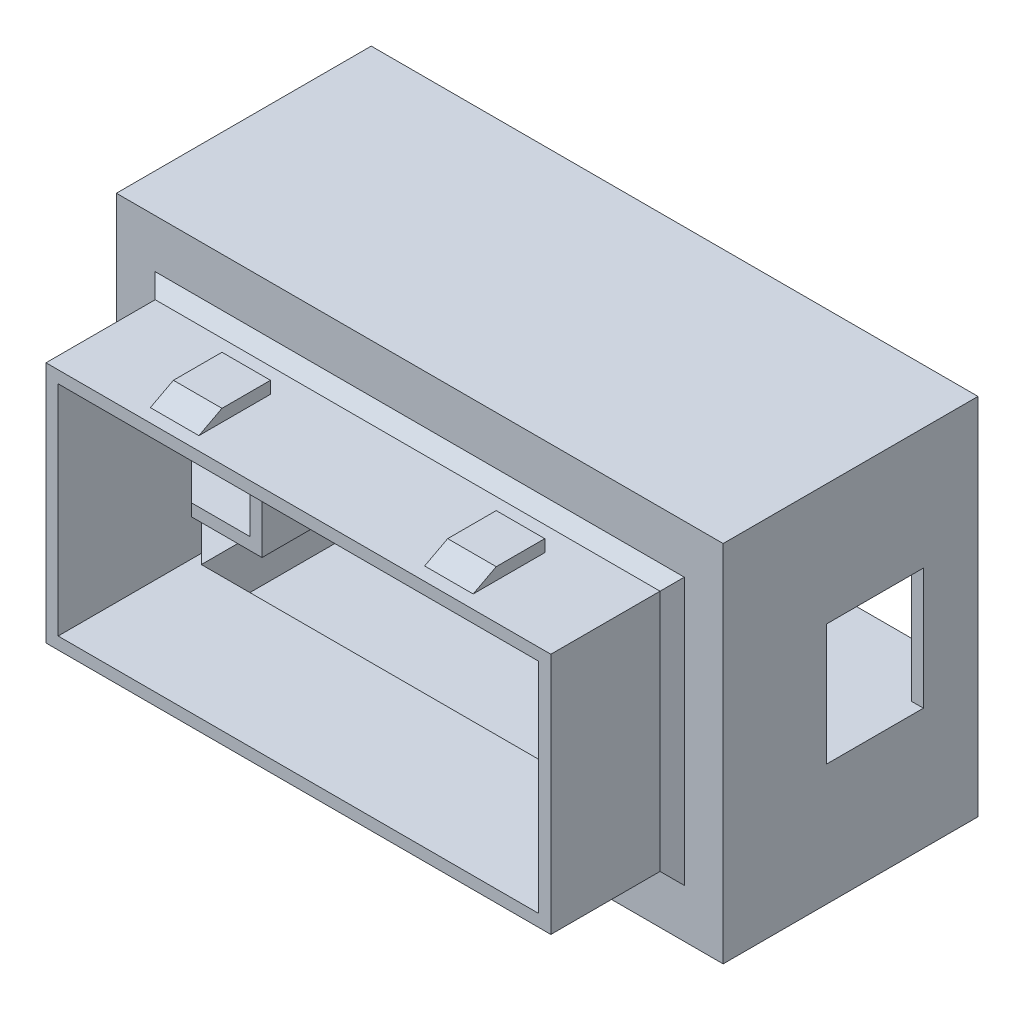
from build123d import *

# Parameters (mm, degrees)
SKETCH1_W            = 41.6
SKETCH1_H            = 20
SKETCH1_W_2          = 39.6
SKETCH1_H_2          = 18
BOSS_EXTRUDE2_DEPTH  = 10
SKETCH2_W            = 4
SKETCH2_H            = 10
BOSS_EXTRUDE3_DEPTH  = 1
SKETCH3_W            = 3
SKETCH3_H            = 1
CUT_EXTRUDE1_DEPTH   = 27
SKETCH4_W            = 4
SKETCH4_H            = 10
BOSS_EXTRUDE4_DEPTH  = 1
SKETCH5_W            = 3
SKETCH5_H            = 1
CUT_EXTRUDE2_DEPTH   = 27
SKETCH6_W            = 50
SKETCH6_H            = 30
SKETCH6_W_2          = 41.6
SKETCH6_H_2          = 20
SKETCH6_W_3          = 39.6
SKETCH6_H_3          = 18
BOSS_EXTRUDE6_DEPTH  = 1
CHAMFER1_SIZE        = 1
SKETCH7_W            = 50
SKETCH7_H            = 30
SKETCH7_W_2          = 48
SKETCH7_H_2          = 28
BOSS_EXTRUDE7_DEPTH  = 20
SKETCH8_W            = 4.2
SKETCH8_H            = 1
BOSS_EXTRUDE8_DEPTH  = 20
SKETCH9_W            = 4.2
SKETCH9_H            = 1
BOSS_EXTRUDE9_DEPTH  = 20
SKETCH10_W           = 4
SKETCH10_H           = 4
BOSS_EXTRUDE10_DEPTH = 20
SKETCH11_W           = 2
SKETCH11_H           = 10
CUT_EXTRUDE3_DEPTH   = 1
SKETCH12_W           = 2
SKETCH12_H           = 10
CUT_EXTRUDE4_DEPTH   = 1
SKETCH13_R           = 1.5
CUT_EXTRUDE5_DEPTH   = 10
CHAMFER2_SIZE        = 5
CHAMFER3_SIZE        = 5
CHAMFER4_SIZE        = 4


# Some blends are built 0.0001 mm under size
with BuildPart() as part:
    # Sketch1 → Boss-Extrude2 (new body)
    with BuildSketch(Plane.XY):
        Rectangle(SKETCH1_W, SKETCH1_H)
        Rectangle(SKETCH1_W_2, SKETCH1_H_2, mode=Mode.SUBTRACT)
    extrude(amount=BOSS_EXTRUDE2_DEPTH)

    # Sketch2 → Boss-Extrude3 (add)
    with BuildSketch(Plane.XZ.offset(10)):
        with Locations((-11.3, 5)):
            Rectangle(SKETCH2_W, SKETCH2_H)
        with Locations((11.3, 5)):
            Rectangle(SKETCH2_W, SKETCH2_H)
    extrude(amount=BOSS_EXTRUDE3_DEPTH)

    # Sketch3 → Cut-Extrude1 (cut)
    with BuildSketch(Plane.ZY.offset(13.3)):
        Polygon((8.900149248, -10), (7, -11), (10, -11), (10, -10), align=None)
        with Locations((1.5, -10.5)):
            Rectangle(SKETCH3_W, SKETCH3_H)
    extrude(amount=-CUT_EXTRUDE1_DEPTH, mode=Mode.SUBTRACT)

    # Sketch4 → Boss-Extrude4 (add)
    with BuildSketch(Plane(origin=(0, 10, 0), x_dir=(1, 0, 0), z_dir=(0, 1, 0))):
        with Locations((11.3, -5)):
            Rectangle(SKETCH4_W, SKETCH4_H)
        with Locations((-11.3, -5)):
            Rectangle(SKETCH4_W, SKETCH4_H)
    extrude(amount=BOSS_EXTRUDE4_DEPTH)

    # Sketch5 → Cut-Extrude2 (cut)
    with BuildSketch(Plane(origin=(13.3, 0, 0), x_dir=(0, 0, -1), z_dir=(1, 0, 0))):
        Polygon((-7, 11), (-10, 11), (-10, 10), (-8.900149248, 10), align=None)
        with Locations((-1.5, 10.5)):
            Rectangle(SKETCH5_W, SKETCH5_H)
    extrude(amount=-CUT_EXTRUDE2_DEPTH, mode=Mode.SUBTRACT)

    # Sketch6 → Boss-Extrude6 (add)
    # profile 1 of 2: a face of its own
    with BuildSketch(Plane(origin=(0, 0, 0), x_dir=(-1, 0, 0), z_dir=(0, 0, -1))):
        Rectangle(SKETCH6_W, SKETCH6_H)
        Rectangle(SKETCH6_W_2, SKETCH6_H_2, mode=Mode.SUBTRACT)
    # profile 2 of 2: a face of its own
    with BuildSketch(Plane(origin=(0, 0, 0), x_dir=(-1, 0, 0), z_dir=(0, 0, -1))):
        Rectangle(SKETCH6_W_2, SKETCH6_H_2)
        Rectangle(SKETCH6_W_3, SKETCH6_H_3, mode=Mode.SUBTRACT)
    extrude(amount=BOSS_EXTRUDE6_DEPTH)

    # Chamfer1
    chamfer1_edges = [part.edges().sort_by_distance(p)[0] for p in [
        (0, -10, 0),
        (-20.8, 0, 0),
        (0, 10, 0),
        (20.8, 0, 0),
    ]]
    chamfer(chamfer1_edges, length=CHAMFER1_SIZE)

    # Sketch7 → Boss-Extrude7 (add)
    with BuildSketch(Plane(origin=(0, 0, -1), x_dir=(-1, 0, 0), z_dir=(0, 0, -1))):
        Rectangle(SKETCH7_W, SKETCH7_H)
        Rectangle(SKETCH7_W_2, SKETCH7_H_2, mode=Mode.SUBTRACT)
    extrude(amount=BOSS_EXTRUDE7_DEPTH)

    # Sketch8 → Boss-Extrude8 (add)
    with BuildSketch(Plane(origin=(0, 0, -1), x_dir=(-1, 0, 0), z_dir=(0, 0, -1))):
        Polygon((-15, -5), (-19.8, -5), (-19.8, -6), (-14, -6), (-14, 6), (-19.8, 6), (-19.8, 5), (-15, 5), align=None)
        with Locations((-21.9, 5.5)):
            Rectangle(SKETCH8_W, SKETCH8_H)
        with Locations((-21.9, -5.5)):
            Rectangle(SKETCH8_W, SKETCH8_H)
    extrude(amount=BOSS_EXTRUDE8_DEPTH)

    # Sketch9 → Boss-Extrude9 (add)
    with BuildSketch(Plane(origin=(0, 0, -1), x_dir=(-1, 0, 0), z_dir=(0, 0, -1))):
        Polygon((15, 5), (19.8, 5), (19.8, 6), (14, 6), (14, -6), (19.8, -6), (19.8, -5), (15, -5), align=None)
        with Locations((21.9, 5.5)):
            Rectangle(SKETCH9_W, SKETCH9_H)
        with Locations((21.9, -5.5)):
            Rectangle(SKETCH9_W, SKETCH9_H)
    extrude(amount=BOSS_EXTRUDE9_DEPTH)

    # Sketch10 → Boss-Extrude10 (add)
    with BuildSketch(Plane(origin=(0, 0, -1), x_dir=(-1, 0, 0), z_dir=(0, 0, -1))):
        with Locations((-22, 12)):
            Rectangle(SKETCH10_W, SKETCH10_H)
        with Locations((22, 12)):
            Rectangle(SKETCH10_W, SKETCH10_H)
        with Locations((22, -12)):
            Rectangle(SKETCH10_W, SKETCH10_H)
        with Locations((-22, -12)):
            Rectangle(SKETCH10_W, SKETCH10_H)
    extrude(amount=BOSS_EXTRUDE10_DEPTH)

    # Sketch11 → Cut-Extrude3 (cut)
    with BuildSketch(Plane.ZY.offset(25)):
        Polygon((-10.5, -5), (-10.5, 5), (-16.5, 5), (-16.5, 0), (-16.5, -5), align=None)
        with Locations((-9.5, 0)):
            Rectangle(SKETCH11_W, SKETCH11_H)
    extrude(amount=-CUT_EXTRUDE3_DEPTH, mode=Mode.SUBTRACT)

    # Sketch12 → Cut-Extrude4 (cut)
    with BuildSketch(Plane(origin=(25, 0, 0), x_dir=(0, 0, -1), z_dir=(1, 0, 0))):
        with Locations((9.5, 0)):
            Rectangle(SKETCH12_W, SKETCH12_H)
        Polygon((16.5, 5), (10.5, 5), (10.5, -5), (16.5, -5), (16.5, 0), align=None)
    extrude(amount=-CUT_EXTRUDE4_DEPTH, mode=Mode.SUBTRACT)

    # Sketch13 → Cut-Extrude5 (cut)
    with BuildSketch(Plane(origin=(0, 0, -21), x_dir=(-1, 0, 0), z_dir=(0, 0, -1))):
        with Locations((-22.5, 12.5)):
            Circle(SKETCH13_R)
        with Locations((22.5, 12.5)):
            Circle(SKETCH13_R)
        with Locations((22.5, -12.5)):
            Circle(SKETCH13_R)
        with Locations((-22.5, -12.5)):
            Circle(SKETCH13_R)
    extrude(amount=-CUT_EXTRUDE5_DEPTH, mode=Mode.SUBTRACT)

    # Chamfer2
    chamfer2_edges = [part.edges().sort_by_distance(p)[0] for p in [
        (0, 14, -1),
        (0, -14, -1),
    ]]
    chamfer(chamfer2_edges, length=CHAMFER2_SIZE - 0.0001)  # a hair under: the kernel refuses the full size

    # Chamfer3
    # the kernel refuses this chamfer: 5 mm, written as the material it adds along each edge
    with BuildSketch(Plane(origin=(24, -21.85851494, -1), x_dir=(-0.9996219169112968, 0, 0.02749587661058636), z_dir=(0, 1, 0))) as chamfer3_piece_1_section:
        Polygon((CHAMFER3_SIZE * 0.999621916911, -CHAMFER3_SIZE * 0.0274958766106), (-CHAMFER3_SIZE * 0.0274958766106, -CHAMFER3_SIZE * 0.999621916911), (0, 0), align=None)
    chamfer3_piece_1 = extrude(amount=28.71692988, mode=Mode.PRIVATE)
    chamfer3_piece_1 = split(chamfer3_piece_1, bisect_by=Plane(origin=(19.8, -10.000025, -1.99995), z_dir=(1, 0, 0)), keep=Keep.TOP, mode=Mode.PRIVATE)
    chamfer3_piece_1 = split(chamfer3_piece_1, bisect_by=Plane(origin=(19.999975, -5, -1.99995), z_dir=(0, -1, 0)), keep=Keep.TOP, mode=Mode.PRIVATE)
    chamfer3_piece_1 = split(chamfer3_piece_1, bisect_by=Plane(origin=(19.999975, -10.0000375, -1.9999375), z_dir=(0, 0.7071067811865476, -0.7071067811865476)), keep=Keep.TOP, mode=Mode.PRIVATE)
    add(chamfer3_piece_1)
    with BuildSketch(Plane(origin=(24, -21.85851494, -1), x_dir=(-0.9996219169112968, 0, 0.02749587661058636), z_dir=(0, 1, 0))) as chamfer3_piece_2_section:
        Polygon((CHAMFER3_SIZE * 0.999621916911, -CHAMFER3_SIZE * 0.0274958766106), (-CHAMFER3_SIZE * 0.0274958766106, -CHAMFER3_SIZE * 0.999621916911), (0, 0), align=None)
    chamfer3_piece_2 = extrude(amount=28.71692988, mode=Mode.PRIVATE)
    chamfer3_piece_2 = split(chamfer3_piece_2, bisect_by=Plane(origin=(19.599975009, -9, -1.399950019), z_dir=(0, -1, 0)), keep=Keep.TOP, mode=Mode.PRIVATE)
    chamfer3_piece_2 = split(chamfer3_piece_2, bisect_by=Plane(origin=(19.599975009, -9.300037514, -1.299937514), z_dir=(0, 0.7071067811865476, -0.7071067811865476)), keep=Keep.TOP, mode=Mode.PRIVATE)
    add(chamfer3_piece_2)
    with BuildSketch(Plane(origin=(24, -21.85851494, -1), x_dir=(-0.9996219169112968, 0, 0.02749587661058636), z_dir=(0, 1, 0))) as chamfer3_piece_3_section:
        Polygon((CHAMFER3_SIZE * 0.999621916911, -CHAMFER3_SIZE * 0.0274958766106), (-CHAMFER3_SIZE * 0.0274958766106, -CHAMFER3_SIZE * 0.999621916911), (0, 0), align=None)
    chamfer3_piece_3 = extrude(amount=28.71692988, mode=Mode.PRIVATE)
    chamfer3_piece_3 = split(chamfer3_piece_3, bisect_by=Plane(origin=(19.8, 6.42920747, -1.451851852), z_dir=(1, 0, 0)), keep=Keep.TOP, mode=Mode.PRIVATE)
    chamfer3_piece_3 = split(chamfer3_piece_3, bisect_by=Plane(origin=(19.903703704, 5, -1.451851852), z_dir=(0, 1, 0)), keep=Keep.TOP, mode=Mode.PRIVATE)
    add(chamfer3_piece_3)
    with BuildSketch(Plane(origin=(-24, 21.85851494, -1), x_dir=(0.9996219169112968, 0, 0.02749587661058636), z_dir=(0, -1, 0))) as chamfer3_piece_4_section:
        Polygon((CHAMFER3_SIZE * 0.999621916911, -CHAMFER3_SIZE * 0.0274958766106), (-CHAMFER3_SIZE * 0.0274958766106, -CHAMFER3_SIZE * 0.999621916911), (0, 0), align=None)
    chamfer3_piece_4 = extrude(amount=28.71692988, mode=Mode.PRIVATE)
    chamfer3_piece_4 = split(chamfer3_piece_4, bisect_by=Plane(origin=(-19.8, 10.000025, -1.99995), z_dir=(-1, 0, 0)), keep=Keep.TOP, mode=Mode.PRIVATE)
    chamfer3_piece_4 = split(chamfer3_piece_4, bisect_by=Plane(origin=(-19.999975, 15, -1.99995), z_dir=(0, -1, 0)), keep=Keep.TOP, mode=Mode.PRIVATE)
    chamfer3_piece_4 = split(chamfer3_piece_4, bisect_by=Plane(origin=(-19.999975, 5, -1.99995), z_dir=(0, 1, 0)), keep=Keep.TOP, mode=Mode.PRIVATE)
    add(chamfer3_piece_4)
    with BuildSketch(Plane(origin=(-24, 21.85851494, -1), x_dir=(0.9996219169112968, 0, 0.02749587661058636), z_dir=(0, -1, 0))) as chamfer3_piece_5_section:
        Polygon((CHAMFER3_SIZE * 0.999621916911, -CHAMFER3_SIZE * 0.0274958766106), (-CHAMFER3_SIZE * 0.0274958766106, -CHAMFER3_SIZE * 0.999621916911), (0, 0), align=None)
    chamfer3_piece_5 = extrude(amount=28.71692988, mode=Mode.PRIVATE)
    chamfer3_piece_5 = split(chamfer3_piece_5, bisect_by=Plane(origin=(-19.599975009, 9, -1.399950019), z_dir=(0, 1, 0)), keep=Keep.TOP, mode=Mode.PRIVATE)
    chamfer3_piece_5 = split(chamfer3_piece_5, bisect_by=Plane(origin=(-19.599975009, 15, -1.399950019), z_dir=(0, -1, 0)), keep=Keep.TOP, mode=Mode.PRIVATE)
    add(chamfer3_piece_5)
    with BuildSketch(Plane(origin=(-24, 21.85851494, -1), x_dir=(0.9996219169112968, 0, 0.02749587661058636), z_dir=(0, -1, 0))) as chamfer3_piece_6_section:
        Polygon((CHAMFER3_SIZE * 0.999621916911, -CHAMFER3_SIZE * 0.0274958766106), (-CHAMFER3_SIZE * 0.0274958766106, -CHAMFER3_SIZE * 0.999621916911), (0, 0), align=None)
    chamfer3_piece_6 = extrude(amount=28.71692988, mode=Mode.PRIVATE)
    chamfer3_piece_6 = split(chamfer3_piece_6, bisect_by=Plane(origin=(-19.8, -6.42920747, -1.451851852), z_dir=(-1, 0, 0)), keep=Keep.TOP, mode=Mode.PRIVATE)
    chamfer3_piece_6 = split(chamfer3_piece_6, bisect_by=Plane(origin=(-19.903703704, -6, -1.451851852), z_dir=(0, -1, 0)), keep=Keep.TOP, mode=Mode.PRIVATE)
    add(chamfer3_piece_6)
    with BuildSketch(Plane(origin=(-24, 6.85841494, -1), x_dir=(0.9996219169112968, 0, 0.02749587661058636), z_dir=(0, -1, 0))) as chamfer3_piece_7_section:
        Polygon((CHAMFER3_SIZE * 0.999621916911, -CHAMFER3_SIZE * 0.0274958766106), (-CHAMFER3_SIZE * 0.0274958766106, -CHAMFER3_SIZE * 0.999621916911), (0, 0), align=None)
    chamfer3_piece_7 = extrude(amount=28.71692988, mode=Mode.PRIVATE)
    chamfer3_piece_7 = split(chamfer3_piece_7, bisect_by=Plane(origin=(-19.8, 6.42920747, -1.451851852), z_dir=(-1, 0, 0)), keep=Keep.TOP, mode=Mode.PRIVATE)
    chamfer3_piece_7 = split(chamfer3_piece_7, bisect_by=Plane(origin=(-19.903703704, 5, -1.451851852), z_dir=(0, 1, 0)), keep=Keep.TOP, mode=Mode.PRIVATE)
    add(chamfer3_piece_7)
    with BuildSketch(Plane(origin=(-24, -6, -1), x_dir=(0.9996219169112968, 0, 0.02749587661058636), z_dir=(0, -1, 0))) as chamfer3_piece_8_section:
        Polygon((CHAMFER3_SIZE * 0.999621916911, -CHAMFER3_SIZE * 0.0274958766106), (-CHAMFER3_SIZE * 0.0274958766106, -CHAMFER3_SIZE * 0.999621916911), (0, 0), align=None)
    chamfer3_piece_8 = extrude(amount=15.85851494, mode=Mode.PRIVATE)
    chamfer3_piece_8 = split(chamfer3_piece_8, bisect_by=Plane(origin=(-19.8, -7.5, -1.451851852), z_dir=(-1, 0, 0)), keep=Keep.TOP, mode=Mode.PRIVATE)
    chamfer3_piece_8 = split(chamfer3_piece_8, bisect_by=Plane(origin=(-19.903703704, -8.475975926, -0.475875926), z_dir=(0, 0.7071067811865476, -0.7071067811865476)), keep=Keep.TOP, mode=Mode.PRIVATE)
    add(chamfer3_piece_8)
    with BuildSketch(Plane(origin=(-24, 6.85841494, -1), x_dir=(0.9996219169112968, 0, 0.02749587661058636), z_dir=(0, -1, 0))) as chamfer3_piece_9_section:
        Polygon((CHAMFER3_SIZE * 0.999621916911, -CHAMFER3_SIZE * 0.0274958766106), (-CHAMFER3_SIZE * 0.0274958766106, -CHAMFER3_SIZE * 0.999621916911), (0, 0), align=None)
    chamfer3_piece_9 = extrude(amount=28.71692988, mode=Mode.PRIVATE)
    chamfer3_piece_9 = split(chamfer3_piece_9, bisect_by=Plane(origin=(-19.599975009, -9, -1.399950019), z_dir=(0, -1, 0)), keep=Keep.TOP, mode=Mode.PRIVATE)
    chamfer3_piece_9 = split(chamfer3_piece_9, bisect_by=Plane(origin=(-19.599975009, -9.300037514, -1.299937514), z_dir=(0, 0.7071067811865476, -0.7071067811865476)), keep=Keep.TOP, mode=Mode.PRIVATE)
    add(chamfer3_piece_9)
    with BuildSketch(Plane(origin=(24, -6.85841494, -1), x_dir=(-0.9996219169112968, 0, 0.02749587661058636), z_dir=(0, 1, 0))) as chamfer3_piece_10_section:
        Polygon((CHAMFER3_SIZE * 0.999621916911, -CHAMFER3_SIZE * 0.0274958766106), (-CHAMFER3_SIZE * 0.0274958766106, -CHAMFER3_SIZE * 0.999621916911), (0, 0), align=None)
    chamfer3_piece_10 = extrude(amount=28.71692988, mode=Mode.PRIVATE)
    chamfer3_piece_10 = split(chamfer3_piece_10, bisect_by=Plane(origin=(19.8, -6.42920747, -1.451851852), z_dir=(1, 0, 0)), keep=Keep.TOP, mode=Mode.PRIVATE)
    chamfer3_piece_10 = split(chamfer3_piece_10, bisect_by=Plane(origin=(19.903703704, -5, -1.451851852), z_dir=(0, -1, 0)), keep=Keep.TOP, mode=Mode.PRIVATE)
    add(chamfer3_piece_10)
    with BuildSketch(Plane(origin=(24, -6.85841494, -1), x_dir=(-0.9996219169112968, 0, 0.02749587661058636), z_dir=(0, 1, 0))) as chamfer3_piece_11_section:
        Polygon((CHAMFER3_SIZE * 0.999621916911, -CHAMFER3_SIZE * 0.0274958766106), (-CHAMFER3_SIZE * 0.0274958766106, -CHAMFER3_SIZE * 0.999621916911), (0, 0), align=None)
    chamfer3_piece_11 = extrude(amount=28.71692988, mode=Mode.PRIVATE)
    chamfer3_piece_11 = split(chamfer3_piece_11, bisect_by=Plane(origin=(19.8, 7.5, -1.451851852), z_dir=(1, 0, 0)), keep=Keep.TOP, mode=Mode.PRIVATE)
    chamfer3_piece_11 = split(chamfer3_piece_11, bisect_by=Plane(origin=(19.903703704, 15, -1.451851852), z_dir=(0, -1, 0)), keep=Keep.TOP, mode=Mode.PRIVATE)
    chamfer3_piece_11 = split(chamfer3_piece_11, bisect_by=Plane(origin=(19.903703704, 5, -1.451851852), z_dir=(0, 1, 0)), keep=Keep.TOP, mode=Mode.PRIVATE)
    add(chamfer3_piece_11)
    with BuildSketch(Plane(origin=(24, -6.85841494, -1), x_dir=(-0.9996219169112968, 0, 0.02749587661058636), z_dir=(0, 1, 0))) as chamfer3_piece_12_section:
        Polygon((CHAMFER3_SIZE * 0.999621916911, -CHAMFER3_SIZE * 0.0274958766106), (-CHAMFER3_SIZE * 0.0274958766106, -CHAMFER3_SIZE * 0.999621916911), (0, 0), align=None)
    chamfer3_piece_12 = extrude(amount=28.71692988, mode=Mode.PRIVATE)
    chamfer3_piece_12 = split(chamfer3_piece_12, bisect_by=Plane(origin=(19.599975009, 9, -1.399950019), z_dir=(0, 1, 0)), keep=Keep.TOP, mode=Mode.PRIVATE)
    chamfer3_piece_12 = split(chamfer3_piece_12, bisect_by=Plane(origin=(19.599975009, 15, -1.399950019), z_dir=(0, -1, 0)), keep=Keep.TOP, mode=Mode.PRIVATE)
    add(chamfer3_piece_12)

    # Chamfer4
    chamfer4_edges = [part.edges().sort_by_distance(p)[0] for p in [
        (24, 0, -1),
        (-24, 0, -1),
    ]]
    chamfer(chamfer4_edges, length=CHAMFER4_SIZE)


solid = part.part
